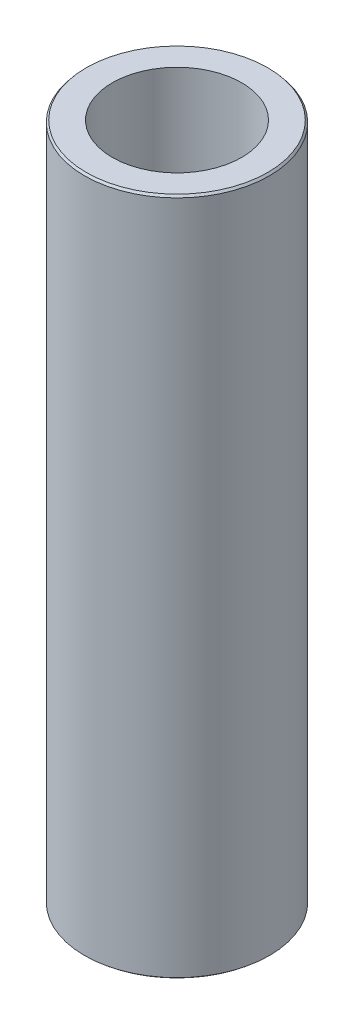
from build123d import *
from OCP.BRepFilletAPI import BRepFilletAPI_MakeChamfer

# Parameters (mm, degrees)
SKETCH1_R           = 60
BOSS_EXTRUDE1_DEPTH = 440.722868494
SKETCH2_R           = 42.002486627
CUT_EXTRUDE1_DEPTH  = 449.816941317
CHAMFER1_SIZE       = 1.337303405
CHAMFER1_SIZE2      = 1.11436959


with BuildPart() as part:
    # Sketch1 → Boss-Extrude1 (new body)
    with BuildSketch(Plane(origin=(0, 0, 0), x_dir=(1, 0, 0), z_dir=(0, 1, 0))):
        Circle(SKETCH1_R)
    extrude(amount=BOSS_EXTRUDE1_DEPTH)

    # Sketch2 → Cut-Extrude1 (cut, through all)
    with BuildSketch(Plane(origin=(0, 0, 0), x_dir=(1, 0, 0), z_dir=(0, 1, 0))):
        Circle(SKETCH2_R)
    extrude(amount=CUT_EXTRUDE1_DEPTH, mode=Mode.SUBTRACT)

    # Chamfer1: one chamfer whose edges measure the first distance from different faces: ONE call of the kernel's chamfer builder (chamfer() names one face for all edges)
    chamfer1_edges_1 = [part.edges().sort_by_distance(p)[0] for p in [
        (-60, 440.722868494, 0),
    ]]
    chamfer1_side_1 = [part.faces().sort_by_distance(p)[0] for p in [
        (-60, 220.361434247, 0),
    ]]
    chamfer1_edges_2 = [part.edges().sort_by_distance(p)[0] for p in [
        (-60, 0, 0),
    ]]
    chamfer1_side_2 = [part.faces().sort_by_distance(p)[0] for p in [
        (-58.302943725, 0, 0),
    ]]
    chamfer1 = BRepFilletAPI_MakeChamfer(part.part.solid().wrapped)
    for e in chamfer1_edges_1:
        chamfer1.Add(CHAMFER1_SIZE, CHAMFER1_SIZE2, e.wrapped, chamfer1_side_1[0].wrapped)  # the first distance lies on this face
    for e in chamfer1_edges_2:
        chamfer1.Add(CHAMFER1_SIZE, CHAMFER1_SIZE2, e.wrapped, chamfer1_side_2[0].wrapped)  # the first distance lies on this face
    add(Compound.cast(chamfer1.Shape()), mode=Mode.REPLACE)


solid = part.part
